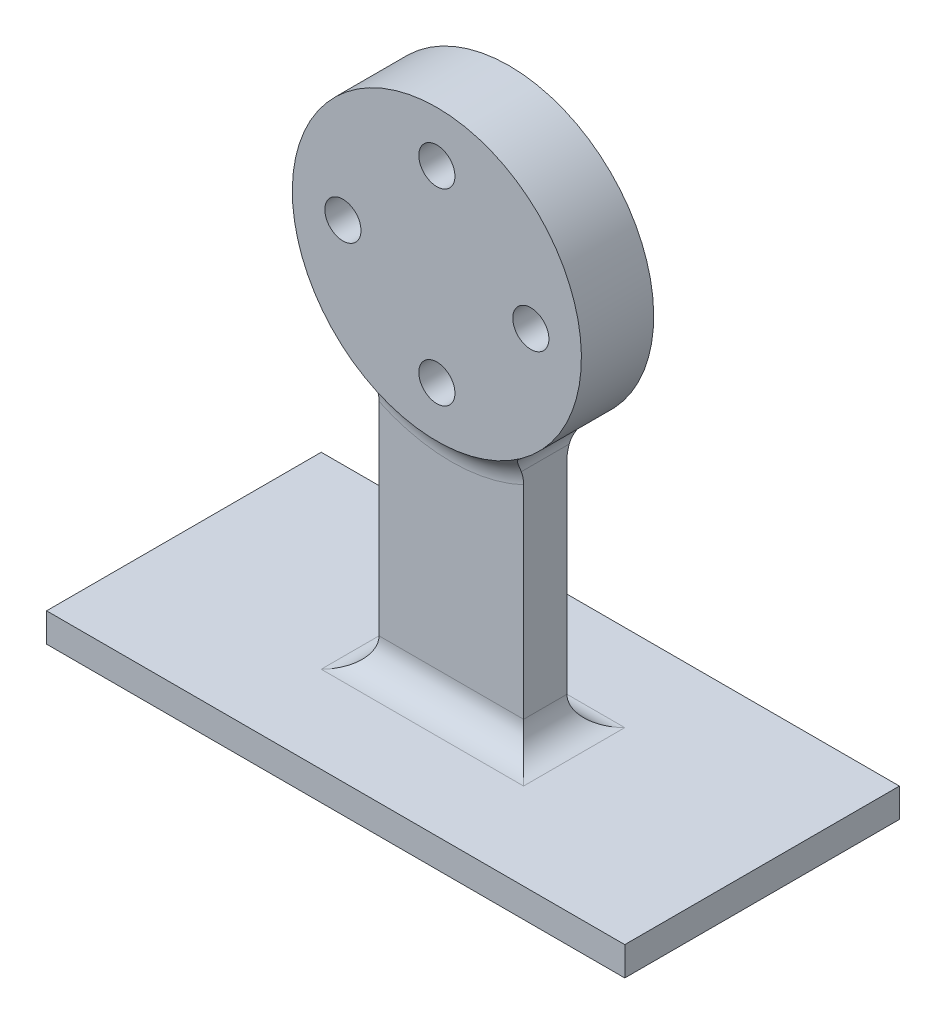
from build123d import *

# Parameters (mm, degrees)
SKETCH1_R            = 10
BOSS_EXTRUDE1_DEPTH  = 5
SKETCH2_R            = 1.25
CUT_EXTRUDE1_DEPTH   = 16
SKETCH3_R            = 2.5
CUT_EXTRUDE2_DEPTH   = 2
EXTRUDE_1_DEPTH      = 1.5
EXTRUDE_1_DEPTH_BACK = 1.5
SKETCH_3_W           = 40
SKETCH_3_H           = 19
EXTRUDE_2_DEPTH      = 2
FILLET_1_R           = 2


with BuildPart() as part:
    # Sketch1 → Boss-Extrude1 (new body)
    with BuildSketch(Plane.XY):
        Circle(SKETCH1_R)
    extrude(amount=BOSS_EXTRUDE1_DEPTH)

    # Sketch2 → Cut-Extrude1 (cut, through all)
    with BuildSketch(Plane.XY.offset(5)):
        with Locations((0, 6.5)):
            Circle(SKETCH2_R)
        with Locations((6.5, 0)):
            Circle(SKETCH2_R)
        with Locations((0, -6.5)):
            Circle(SKETCH2_R)
        with Locations((-6.5, 0)):
            Circle(SKETCH2_R)
    extrude(amount=-CUT_EXTRUDE1_DEPTH, mode=Mode.SUBTRACT)

    # Sketch3 → Cut-Extrude2 (cut)
    with BuildSketch(Plane(origin=(0, 0, 0), x_dir=(-1, 0, 0), z_dir=(0, 0, -1))):
        Circle(SKETCH3_R)
    extrude(amount=-CUT_EXTRUDE2_DEPTH, mode=Mode.SUBTRACT)

    # 草图2 → 凸台-拉伸1 (add, two sides: drawn at the far end of the back side and taken through both)
    with BuildSketch(Plane.XY.offset(2.5).offset(-EXTRUDE_1_DEPTH_BACK)):
        with BuildLine():
            Line((-5, -8.660254038), (-5, -26.660254038))
            Line((-5, -26.660254038), (5, -26.660254038))
            Line((5, -26.660254038), (5, -8.660254038))
            ThreePointArc((5, -8.660254038), (0, -10), (-5, -8.660254038))
        make_face()
    extrude(amount=EXTRUDE_1_DEPTH + EXTRUDE_1_DEPTH_BACK)

    # 草图3 → 凸台-拉伸2 (add)
    with BuildSketch(Plane.XZ.offset(26.660254038)):
        with Locations((0, 2.5)):
            Rectangle(SKETCH_3_W, SKETCH_3_H)
    extrude(amount=EXTRUDE_2_DEPTH)

    # 圆角1
    # the kernel refuses this fillet: 2 mm, written as the material it adds along each edge
    with BuildSketch(Plane(origin=(-5, -8.660254038, 4), x_dir=(0, -1, 0), z_dir=(0, 0, -1))) as fillet_1_piece_1:
        with BuildLine():
            CenterArc((1.086540307, 2), FILLET_1_R, 215.685334713, 54.314665287)
            Line((-0.537925417, 0.833333333), (-0.570414732, 0.81))
            ThreePointArc((-0.570414732, 0.81), (-0.292230876, 0.40164682), (-0.034641016, -0.02))
            Line((-0.034641016, -0.02), (0, -0.04))
            Line((0, -0.04), (1.086540307, -0.04))
            Line((1.086540307, -0.04), (1.086540307, 0))
        make_face()
    extrude(amount=3)
    with BuildSketch(Plane(origin=(0, 0, 1), x_dir=(0.8172880266959527, -0.5762293652873269, 0), z_dir=(0.5762293652873269, 0.8172880266959527, 0))) as fillet_1_piece_2_section:
        with BuildLine():
            CenterArc((11.732050808, 2), FILLET_1_R, 210, 60)
            Line((10, 1), (9.965358984, 0.98))
            ThreePointArc((9.965358984, 0.98), (9.96, 0.5), (9.96, 0))
            Line((9.96, 0), (10, -0.04))
            Line((10, -0.04), (11.732050808, -0.04))
            Line((11.732050808, -0.04), (11.732050808, 0))
        make_face()
    fillet_1_piece_2 = revolve(axis=Axis((0, 0, 1), (0, 0, -1)), revolution_arc=109.628458137, mode=Mode.PRIVATE)
    fillet_1_piece_2 = split(fillet_1_piece_2, bisect_by=Plane(origin=(5, -10.001483163, 0.740495883), z_dir=(-1, 0, 0)), keep=Keep.TOP, mode=Mode.PRIVATE)
    fillet_1_piece_2 = split(fillet_1_piece_2, bisect_by=Plane(origin=(-5, -10.001483163, 0.740495883), z_dir=(1, 0, 0)), keep=Keep.TOP, mode=Mode.PRIVATE)
    add(fillet_1_piece_2)
    with BuildSketch(Plane(origin=(5, -8.660254038, 4), x_dir=(0, -1, 0), z_dir=(0, 0, -1))) as fillet_1_piece_3:
        with BuildLine():
            CenterArc((1.086540307, -2), FILLET_1_R, 90, 54.314665287)
            Line((-0.537925417, -0.833333333), (-0.570414732, -0.81))
            ThreePointArc((-0.570414732, -0.81), (-0.292230876, -0.40164682), (-0.034641016, 0.02))
            Line((-0.034641016, 0.02), (0, 0.04))
            Line((0, 0.04), (1.086540307, 0.04))
            Line((1.086540307, 0.04), (1.086540307, 0))
        make_face()
    extrude(amount=3)
    with BuildSketch(Plane(origin=(5, -26.660254038, 1), x_dir=(1, 0, 0), z_dir=(0, 0, 1))) as fillet_1_piece_4:
        with BuildLine():
            CenterArc((FILLET_1_R, FILLET_1_R), FILLET_1_R, 180, 90)
            Line((0, FILLET_1_R), (-FILLET_1_R * 0.02, FILLET_1_R))
            Line((-FILLET_1_R * 0.02, FILLET_1_R), (-FILLET_1_R * 0.02, -FILLET_1_R * 0.02))
            Line((-FILLET_1_R * 0.02, -FILLET_1_R * 0.02), (FILLET_1_R, -FILLET_1_R * 0.02))
            Line((FILLET_1_R, -FILLET_1_R * 0.02), (FILLET_1_R, 0))
        make_face()
    extrude(amount=3)
    with BuildSketch(Plane(origin=(-5, -26.660254038, 1), x_dir=(0, 0, -1), z_dir=(1, 0, 0))) as fillet_1_piece_5:
        with BuildLine():
            CenterArc((FILLET_1_R, FILLET_1_R), FILLET_1_R, 180, 90)
            Line((0, FILLET_1_R), (-FILLET_1_R * 0.02, FILLET_1_R))
            Line((-FILLET_1_R * 0.02, FILLET_1_R), (-FILLET_1_R * 0.02, -FILLET_1_R * 0.02))
            Line((-FILLET_1_R * 0.02, -FILLET_1_R * 0.02), (FILLET_1_R, -FILLET_1_R * 0.02))
            Line((FILLET_1_R, -FILLET_1_R * 0.02), (FILLET_1_R, 0))
        make_face()
    extrude(amount=10)
    with BuildSketch(Plane(origin=(-5, -26.660254038, 1), x_dir=(-1, 0, 0), z_dir=(0, 0, 1))) as fillet_1_piece_6:
        with BuildLine():
            CenterArc((FILLET_1_R, -FILLET_1_R), FILLET_1_R, 90, 90)
            Line((0, -FILLET_1_R), (-FILLET_1_R * 0.02, -FILLET_1_R))
            Line((-FILLET_1_R * 0.02, -FILLET_1_R), (-FILLET_1_R * 0.02, FILLET_1_R * 0.02))
            Line((-FILLET_1_R * 0.02, FILLET_1_R * 0.02), (FILLET_1_R, FILLET_1_R * 0.02))
            Line((FILLET_1_R, FILLET_1_R * 0.02), (FILLET_1_R, 0))
        make_face()
    extrude(amount=3)
    with BuildSketch(Plane(origin=(0, 0, 4), x_dir=(0.8172880266959527, -0.5762293652873269, 0), z_dir=(0.5762293652873269, 0.8172880266959527, 0))) as fillet_1_piece_7_section:
        with BuildLine():
            CenterArc((11.732050808, -2), FILLET_1_R, 90, 60)
            Line((10, -1), (9.965358984, -0.98))
            ThreePointArc((9.965358984, -0.98), (9.96, -0.5), (9.96, 0))
            Line((9.96, 0), (10, 0.04))
            Line((10, 0.04), (11.732050808, 0.04))
            Line((11.732050808, 0.04), (11.732050808, 0))
        make_face()
    fillet_1_piece_7 = revolve(axis=Axis((0, 0, 4), (0, 0, -1)), revolution_arc=109.628458137, mode=Mode.PRIVATE)
    fillet_1_piece_7 = split(fillet_1_piece_7, bisect_by=Plane(origin=(-5, -10.001483163, 4.259504117), z_dir=(1, 0, 0)), keep=Keep.TOP, mode=Mode.PRIVATE)
    fillet_1_piece_7 = split(fillet_1_piece_7, bisect_by=Plane(origin=(5, -10.001483163, 4.259504117), z_dir=(-1, 0, 0)), keep=Keep.TOP, mode=Mode.PRIVATE)
    add(fillet_1_piece_7)
    with BuildSketch(Plane(origin=(-5, -26.660254038, 4), x_dir=(0, 0, 1), z_dir=(1, 0, 0))) as fillet_1_piece_8:
        with BuildLine():
            CenterArc((FILLET_1_R, -FILLET_1_R), FILLET_1_R, 90, 90)
            Line((0, -FILLET_1_R), (-FILLET_1_R * 0.02, -FILLET_1_R))
            Line((-FILLET_1_R * 0.02, -FILLET_1_R), (-FILLET_1_R * 0.02, FILLET_1_R * 0.02))
            Line((-FILLET_1_R * 0.02, FILLET_1_R * 0.02), (FILLET_1_R, FILLET_1_R * 0.02))
            Line((FILLET_1_R, FILLET_1_R * 0.02), (FILLET_1_R, 0))
        make_face()
    extrude(amount=10)
    with BuildSketch(Plane(origin=(0, 0, 4), x_dir=(0.8172880266959527, -0.5762293652873269, 0), z_dir=(0.5762293652873269, 0.8172880266959527, 0))) as fillet_1_piece_9a_section:
        with BuildLine():
            CenterArc((11.732050808, -2), FILLET_1_R, 90, 60)
            Line((10, -1), (9.965358984, -0.98))
            ThreePointArc((9.965358984, -0.98), (9.96, -0.5), (9.96, 0))
            Line((9.96, 0), (10, 0.04))
            Line((10, 0.04), (11.732050808, 0.04))
            Line((11.732050808, 0.04), (11.732050808, 0))
        make_face()
    fillet_1_piece_9a = revolve(axis=Axis((0, 0, 4), (0, 0, -1)), revolution_arc=109.628458137, mode=Mode.PRIVATE)
    fillet_1_piece_9a = split(fillet_1_piece_9a, bisect_by=Plane(origin=(-5, -7.746585208, 4.247464025), z_dir=(-1, 0, 0)), keep=Keep.TOP, mode=Mode.PRIVATE)
    with BuildSketch(Plane(origin=(-5, -8.660254038, 6.716350767), x_dir=(0, -1, 0), z_dir=(0, 0, -1))) as fillet_1_piece_9b_section:
        with BuildLine():
            CenterArc((1.086540307, 2), FILLET_1_R, 215.685334713, 54.314665287)
            Line((-0.537925417, 0.833333333), (-0.570414732, 0.81))
            ThreePointArc((-0.570414732, 0.81), (-0.292230876, 0.40164682), (-0.034641016, -0.02))
            Line((-0.034641016, -0.02), (0, -0.04))
            Line((0, -0.04), (1.086540307, -0.04))
            Line((1.086540307, -0.04), (1.086540307, 0))
        make_face()
    fillet_1_piece_9b = extrude(amount=5.716350767, mode=Mode.PRIVATE)
    fillet_1_piece_9b = split(fillet_1_piece_9b, bisect_by=Plane(origin=(-5.179096693, -8.792679458, 4), z_dir=(0, 0, 1)), keep=Keep.TOP, mode=Mode.PRIVATE)
    fillet_1_piece_9b = split(fillet_1_piece_9b, bisect_by=Plane(origin=(-5.179096693, -8.792679458, 5), z_dir=(0, 0, -1)), keep=Keep.TOP, mode=Mode.PRIVATE)
    fillet_1_piece_9 = fillet_1_piece_9a & fillet_1_piece_9b
    add(fillet_1_piece_9)
    with BuildSketch(Plane(origin=(0, 0, 1), x_dir=(0.8172880266959527, -0.5762293652873269, 0), z_dir=(0.5762293652873269, 0.8172880266959527, 0))) as fillet_1_piece_10a_section:
        with BuildLine():
            CenterArc((11.732050808, 2), FILLET_1_R, 210, 60)
            Line((10, 1), (9.965358984, 0.98))
            ThreePointArc((9.965358984, 0.98), (9.96, 0.5), (9.96, 0))
            Line((9.96, 0), (10, -0.04))
            Line((10, -0.04), (11.732050808, -0.04))
            Line((11.732050808, -0.04), (11.732050808, 0))
        make_face()
    fillet_1_piece_10a = revolve(axis=Axis((0, 0, 1), (0, 0, -1)), revolution_arc=109.628458137, mode=Mode.PRIVATE)
    fillet_1_piece_10a = split(fillet_1_piece_10a, bisect_by=Plane(origin=(-5, -7.746585208, 0.752535975), z_dir=(-1, 0, 0)), keep=Keep.TOP, mode=Mode.PRIVATE)
    with BuildSketch(Plane(origin=(-5, -8.660254038, 4), x_dir=(0, -1, 0), z_dir=(0, 0, -1))) as fillet_1_piece_10b_section:
        with BuildLine():
            CenterArc((1.086540307, 2), FILLET_1_R, 215.685334713, 54.314665287)
            Line((-0.537925417, 0.833333333), (-0.570414732, 0.81))
            ThreePointArc((-0.570414732, 0.81), (-0.292230876, 0.40164682), (-0.034641016, -0.02))
            Line((-0.034641016, -0.02), (0, -0.04))
            Line((0, -0.04), (1.086540307, -0.04))
            Line((1.086540307, -0.04), (1.086540307, 0))
        make_face()
    fillet_1_piece_10b = extrude(amount=5.716350767, mode=Mode.PRIVATE)
    fillet_1_piece_10b = split(fillet_1_piece_10b, bisect_by=Plane(origin=(-5.179096693, -8.792679458, 1), z_dir=(0, 0, -1)), keep=Keep.TOP, mode=Mode.PRIVATE)
    fillet_1_piece_10b = split(fillet_1_piece_10b, bisect_by=Plane(origin=(-5.179096693, -8.792679458, 0), z_dir=(0, 0, 1)), keep=Keep.TOP, mode=Mode.PRIVATE)
    fillet_1_piece_10 = fillet_1_piece_10a & fillet_1_piece_10b
    add(fillet_1_piece_10)
    with BuildSketch(Plane(origin=(5, -8.660254038, 4), x_dir=(0, -1, 0), z_dir=(0, 0, -1))) as fillet_1_piece_11a_section:
        with BuildLine():
            CenterArc((1.086540307, -2), FILLET_1_R, 90, 54.314665287)
            Line((-0.537925417, -0.833333333), (-0.570414732, -0.81))
            ThreePointArc((-0.570414732, -0.81), (-0.292230876, -0.40164682), (-0.034641016, 0.02))
            Line((-0.034641016, 0.02), (0, 0.04))
            Line((0, 0.04), (1.086540307, 0.04))
            Line((1.086540307, 0.04), (1.086540307, 0))
        make_face()
    fillet_1_piece_11a = extrude(amount=5.716350767, mode=Mode.PRIVATE)
    fillet_1_piece_11a = split(fillet_1_piece_11a, bisect_by=Plane(origin=(5.179096693, -8.792679458, 1), z_dir=(0, 0, -1)), keep=Keep.TOP, mode=Mode.PRIVATE)
    fillet_1_piece_11a = split(fillet_1_piece_11a, bisect_by=Plane(origin=(5.179096693, -8.792679458, 0), z_dir=(0, 0, 1)), keep=Keep.TOP, mode=Mode.PRIVATE)
    with BuildSketch(Plane(origin=(0, 0, 1), x_dir=(0.8172880266959527, -0.5762293652873269, 0), z_dir=(0.5762293652873269, 0.8172880266959527, 0))) as fillet_1_piece_11b_section:
        with BuildLine():
            CenterArc((11.732050808, 2), FILLET_1_R, 210, 60)
            Line((10, 1), (9.965358984, 0.98))
            ThreePointArc((9.965358984, 0.98), (9.96, 0.5), (9.96, 0))
            Line((9.96, 0), (10, -0.04))
            Line((10, -0.04), (11.732050808, -0.04))
            Line((11.732050808, -0.04), (11.732050808, 0))
        make_face()
    fillet_1_piece_11b = revolve(axis=Axis((0, 0, 1), (0, 0, -1)), revolution_arc=109.628458137, mode=Mode.PRIVATE)
    fillet_1_piece_11b = split(fillet_1_piece_11b, bisect_by=Plane(origin=(5, -7.746585383, 0.752536044), z_dir=(1, 0, 0)), keep=Keep.TOP, mode=Mode.PRIVATE)
    fillet_1_piece_11 = fillet_1_piece_11a & fillet_1_piece_11b
    add(fillet_1_piece_11)
    with BuildSketch(Plane(origin=(0, 0, 4), x_dir=(0.8172880266959527, -0.5762293652873269, 0), z_dir=(0.5762293652873269, 0.8172880266959527, 0))) as fillet_1_piece_12a_section:
        with BuildLine():
            CenterArc((11.732050808, -2), FILLET_1_R, 90, 60)
            Line((10, -1), (9.965358984, -0.98))
            ThreePointArc((9.965358984, -0.98), (9.96, -0.5), (9.96, 0))
            Line((9.96, 0), (10, 0.04))
            Line((10, 0.04), (11.732050808, 0.04))
            Line((11.732050808, 0.04), (11.732050808, 0))
        make_face()
    fillet_1_piece_12a = revolve(axis=Axis((0, 0, 4), (0, 0, -1)), revolution_arc=109.628458137, mode=Mode.PRIVATE)
    fillet_1_piece_12a = split(fillet_1_piece_12a, bisect_by=Plane(origin=(5, -7.746585383, 4.247463956), z_dir=(1, 0, 0)), keep=Keep.TOP, mode=Mode.PRIVATE)
    with BuildSketch(Plane(origin=(5, -8.660254038, 6.716350767), x_dir=(0, -1, 0), z_dir=(0, 0, -1))) as fillet_1_piece_12b_section:
        with BuildLine():
            CenterArc((1.086540307, -2), FILLET_1_R, 90, 54.314665287)
            Line((-0.537925417, -0.833333333), (-0.570414732, -0.81))
            ThreePointArc((-0.570414732, -0.81), (-0.292230876, -0.40164682), (-0.034641016, 0.02))
            Line((-0.034641016, 0.02), (0, 0.04))
            Line((0, 0.04), (1.086540307, 0.04))
            Line((1.086540307, 0.04), (1.086540307, 0))
        make_face()
    fillet_1_piece_12b = extrude(amount=5.716350767, mode=Mode.PRIVATE)
    fillet_1_piece_12b = split(fillet_1_piece_12b, bisect_by=Plane(origin=(5.179096693, -8.792679458, 4), z_dir=(0, 0, 1)), keep=Keep.TOP, mode=Mode.PRIVATE)
    fillet_1_piece_12b = split(fillet_1_piece_12b, bisect_by=Plane(origin=(5.179096693, -8.792679458, 5), z_dir=(0, 0, -1)), keep=Keep.TOP, mode=Mode.PRIVATE)
    fillet_1_piece_12 = fillet_1_piece_12a & fillet_1_piece_12b
    add(fillet_1_piece_12)
    with BuildSketch(Plane(origin=(5, -26.660254038, -4), x_dir=(1, 0, 0), z_dir=(0, 0, 1))) as fillet_1_piece_13a_section:
        with BuildLine():
            CenterArc((FILLET_1_R, FILLET_1_R), FILLET_1_R, 180, 90)
            Line((0, FILLET_1_R), (-FILLET_1_R * 0.02, FILLET_1_R))
            Line((-FILLET_1_R * 0.02, FILLET_1_R), (-FILLET_1_R * 0.02, -FILLET_1_R * 0.02))
            Line((-FILLET_1_R * 0.02, -FILLET_1_R * 0.02), (FILLET_1_R, -FILLET_1_R * 0.02))
            Line((FILLET_1_R, -FILLET_1_R * 0.02), (FILLET_1_R, 0))
        make_face()
    fillet_1_piece_13a = extrude(amount=8, mode=Mode.PRIVATE)
    fillet_1_piece_13a = split(fillet_1_piece_13a, bisect_by=Plane(origin=(5.452790229, -26.207463809, 1), z_dir=(0, 0, -1)), keep=Keep.TOP, mode=Mode.PRIVATE)
    with BuildSketch(Plane(origin=(-5, -26.660254038, 1), x_dir=(0, 0, -1), z_dir=(1, 0, 0))) as fillet_1_piece_13b_section:
        with BuildLine():
            CenterArc((FILLET_1_R, FILLET_1_R), FILLET_1_R, 180, 90)
            Line((0, FILLET_1_R), (-FILLET_1_R * 0.02, FILLET_1_R))
            Line((-FILLET_1_R * 0.02, FILLET_1_R), (-FILLET_1_R * 0.02, -FILLET_1_R * 0.02))
            Line((-FILLET_1_R * 0.02, -FILLET_1_R * 0.02), (FILLET_1_R, -FILLET_1_R * 0.02))
            Line((FILLET_1_R, -FILLET_1_R * 0.02), (FILLET_1_R, 0))
        make_face()
    fillet_1_piece_13b = extrude(amount=15, mode=Mode.PRIVATE)
    fillet_1_piece_13b = split(fillet_1_piece_13b, bisect_by=Plane(origin=(5, -26.207463809, 0.547209771), z_dir=(1, 0, 0)), keep=Keep.TOP, mode=Mode.PRIVATE)
    fillet_1_piece_13 = fillet_1_piece_13a & fillet_1_piece_13b
    add(fillet_1_piece_13)
    with BuildSketch(Plane(origin=(-5, -26.660254038, 4), x_dir=(0, 0, 1), z_dir=(1, 0, 0))) as fillet_1_piece_14a_section:
        with BuildLine():
            CenterArc((FILLET_1_R, -FILLET_1_R), FILLET_1_R, 90, 90)
            Line((0, -FILLET_1_R), (-FILLET_1_R * 0.02, -FILLET_1_R))
            Line((-FILLET_1_R * 0.02, -FILLET_1_R), (-FILLET_1_R * 0.02, FILLET_1_R * 0.02))
            Line((-FILLET_1_R * 0.02, FILLET_1_R * 0.02), (FILLET_1_R, FILLET_1_R * 0.02))
            Line((FILLET_1_R, FILLET_1_R * 0.02), (FILLET_1_R, 0))
        make_face()
    fillet_1_piece_14a = extrude(amount=15, mode=Mode.PRIVATE)
    fillet_1_piece_14a = split(fillet_1_piece_14a, bisect_by=Plane(origin=(5, -26.207463809, 4.452790229), z_dir=(1, 0, 0)), keep=Keep.TOP, mode=Mode.PRIVATE)
    with BuildSketch(Plane(origin=(5, -26.660254038, 1), x_dir=(1, 0, 0), z_dir=(0, 0, 1))) as fillet_1_piece_14b_section:
        with BuildLine():
            CenterArc((FILLET_1_R, FILLET_1_R), FILLET_1_R, 180, 90)
            Line((0, FILLET_1_R), (-FILLET_1_R * 0.02, FILLET_1_R))
            Line((-FILLET_1_R * 0.02, FILLET_1_R), (-FILLET_1_R * 0.02, -FILLET_1_R * 0.02))
            Line((-FILLET_1_R * 0.02, -FILLET_1_R * 0.02), (FILLET_1_R, -FILLET_1_R * 0.02))
            Line((FILLET_1_R, -FILLET_1_R * 0.02), (FILLET_1_R, 0))
        make_face()
    fillet_1_piece_14b = extrude(amount=8, mode=Mode.PRIVATE)
    fillet_1_piece_14b = split(fillet_1_piece_14b, bisect_by=Plane(origin=(5.452790229, -26.207463809, 4), z_dir=(0, 0, 1)), keep=Keep.TOP, mode=Mode.PRIVATE)
    fillet_1_piece_14 = fillet_1_piece_14a & fillet_1_piece_14b
    add(fillet_1_piece_14)
    with BuildSketch(Plane(origin=(-10, -26.660254038, 1), x_dir=(0, 0, -1), z_dir=(1, 0, 0))) as fillet_1_piece_15a_section:
        with BuildLine():
            CenterArc((FILLET_1_R, FILLET_1_R), FILLET_1_R, 180, 90)
            Line((0, FILLET_1_R), (-FILLET_1_R * 0.02, FILLET_1_R))
            Line((-FILLET_1_R * 0.02, FILLET_1_R), (-FILLET_1_R * 0.02, -FILLET_1_R * 0.02))
            Line((-FILLET_1_R * 0.02, -FILLET_1_R * 0.02), (FILLET_1_R, -FILLET_1_R * 0.02))
            Line((FILLET_1_R, -FILLET_1_R * 0.02), (FILLET_1_R, 0))
        make_face()
    fillet_1_piece_15a = extrude(amount=15, mode=Mode.PRIVATE)
    fillet_1_piece_15a = split(fillet_1_piece_15a, bisect_by=Plane(origin=(-5, -26.207463809, 0.547209771), z_dir=(-1, 0, 0)), keep=Keep.TOP, mode=Mode.PRIVATE)
    with BuildSketch(Plane(origin=(-5, -26.660254038, -4), x_dir=(-1, 0, 0), z_dir=(0, 0, 1))) as fillet_1_piece_15b_section:
        with BuildLine():
            CenterArc((FILLET_1_R, -FILLET_1_R), FILLET_1_R, 90, 90)
            Line((0, -FILLET_1_R), (-FILLET_1_R * 0.02, -FILLET_1_R))
            Line((-FILLET_1_R * 0.02, -FILLET_1_R), (-FILLET_1_R * 0.02, FILLET_1_R * 0.02))
            Line((-FILLET_1_R * 0.02, FILLET_1_R * 0.02), (FILLET_1_R, FILLET_1_R * 0.02))
            Line((FILLET_1_R, FILLET_1_R * 0.02), (FILLET_1_R, 0))
        make_face()
    fillet_1_piece_15b = extrude(amount=8, mode=Mode.PRIVATE)
    fillet_1_piece_15b = split(fillet_1_piece_15b, bisect_by=Plane(origin=(-5.452790229, -26.207463809, 1), z_dir=(0, 0, -1)), keep=Keep.TOP, mode=Mode.PRIVATE)
    fillet_1_piece_15 = fillet_1_piece_15a & fillet_1_piece_15b
    add(fillet_1_piece_15)
    with BuildSketch(Plane(origin=(-10, -26.660254038, 4), x_dir=(0, 0, 1), z_dir=(1, 0, 0))) as fillet_1_piece_16a_section:
        with BuildLine():
            CenterArc((FILLET_1_R, -FILLET_1_R), FILLET_1_R, 90, 90)
            Line((0, -FILLET_1_R), (-FILLET_1_R * 0.02, -FILLET_1_R))
            Line((-FILLET_1_R * 0.02, -FILLET_1_R), (-FILLET_1_R * 0.02, FILLET_1_R * 0.02))
            Line((-FILLET_1_R * 0.02, FILLET_1_R * 0.02), (FILLET_1_R, FILLET_1_R * 0.02))
            Line((FILLET_1_R, FILLET_1_R * 0.02), (FILLET_1_R, 0))
        make_face()
    fillet_1_piece_16a = extrude(amount=15, mode=Mode.PRIVATE)
    fillet_1_piece_16a = split(fillet_1_piece_16a, bisect_by=Plane(origin=(-5, -26.207463809, 4.452790229), z_dir=(-1, 0, 0)), keep=Keep.TOP, mode=Mode.PRIVATE)
    with BuildSketch(Plane(origin=(-5, -26.660254038, 1), x_dir=(-1, 0, 0), z_dir=(0, 0, 1))) as fillet_1_piece_16b_section:
        with BuildLine():
            CenterArc((FILLET_1_R, -FILLET_1_R), FILLET_1_R, 90, 90)
            Line((0, -FILLET_1_R), (-FILLET_1_R * 0.02, -FILLET_1_R))
            Line((-FILLET_1_R * 0.02, -FILLET_1_R), (-FILLET_1_R * 0.02, FILLET_1_R * 0.02))
            Line((-FILLET_1_R * 0.02, FILLET_1_R * 0.02), (FILLET_1_R, FILLET_1_R * 0.02))
            Line((FILLET_1_R, FILLET_1_R * 0.02), (FILLET_1_R, 0))
        make_face()
    fillet_1_piece_16b = extrude(amount=8, mode=Mode.PRIVATE)
    fillet_1_piece_16b = split(fillet_1_piece_16b, bisect_by=Plane(origin=(-5.452790229, -26.207463809, 4), z_dir=(0, 0, 1)), keep=Keep.TOP, mode=Mode.PRIVATE)
    fillet_1_piece_16 = fillet_1_piece_16a & fillet_1_piece_16b
    add(fillet_1_piece_16)


solid = part.part
